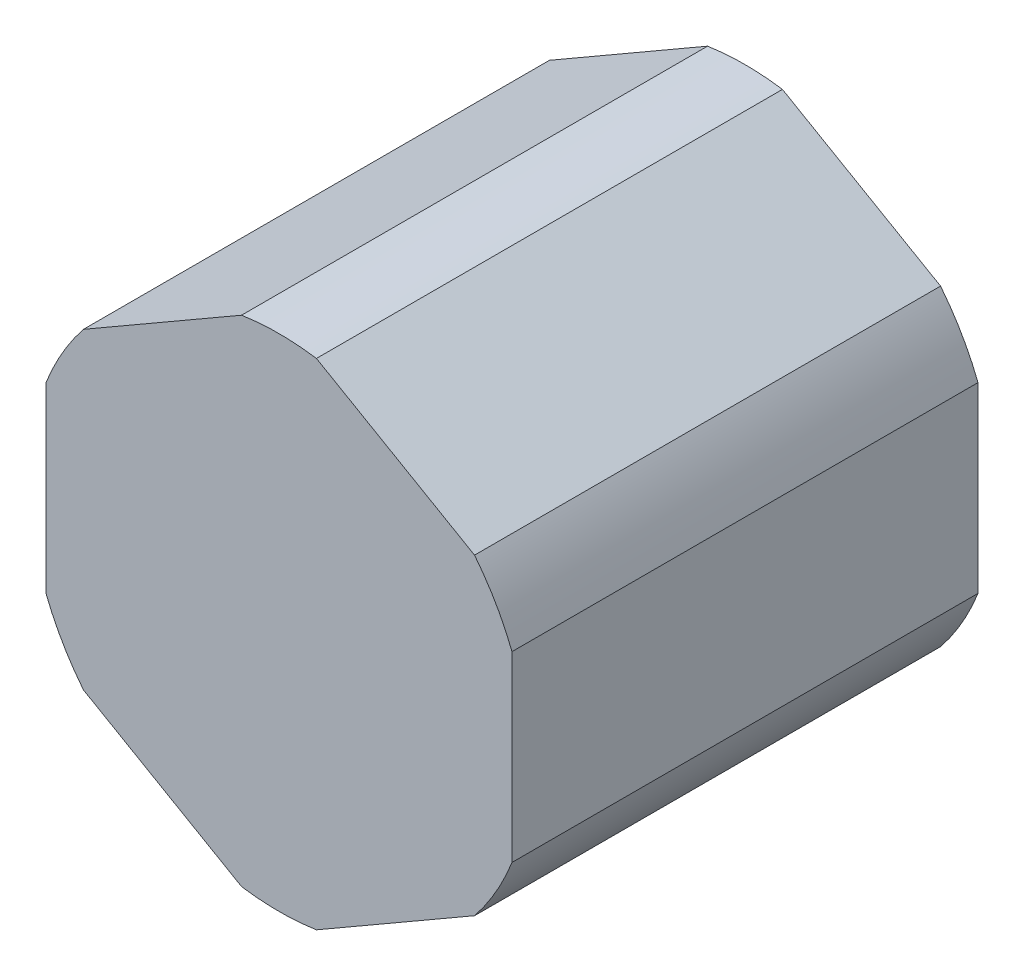
from build123d import *

# Parameters (mm, degrees)
BOSS_EXTRUDE1_DEPTH = 12.7


with BuildPart() as part:
    # Sketch1 → Boss-Extrude1 (new body)
    with BuildSketch(Plane.XY):
        with BuildLine():
            ThreePointArc((6.35, 2.48767683), (5.906206651, 3.40995), (5.329391331, 4.255422899))
            Line((5.329391331, 4.255422899), (1.020608669, 6.743099729))
            ThreePointArc((1.020608669, 6.743099729), (0, 6.8199), (-1.020608669, 6.743099729))
            Line((-1.020608669, 6.743099729), (-5.329391331, 4.255422899))
            ThreePointArc((-5.329391331, 4.255422899), (-5.906206651, 3.40995), (-6.35, 2.48767683))
            Line((-6.35, 2.48767683), (-6.35, -2.48767683))
            ThreePointArc((-6.35, -2.48767683), (-5.906206651, -3.40995), (-5.329391331, -4.255422899))
            Line((-5.329391331, -4.255422899), (-1.020608669, -6.743099729))
            ThreePointArc((-1.020608669, -6.743099729), (0, -6.8199), (1.020608669, -6.743099729))
            Line((1.020608669, -6.743099729), (5.329391331, -4.255422899))
            ThreePointArc((5.329391331, -4.255422899), (5.906206651, -3.40995), (6.35, -2.48767683))
            Line((6.35, -2.48767683), (6.35, 2.48767683))
        make_face()
    extrude(amount=BOSS_EXTRUDE1_DEPTH)


solid = part.part
